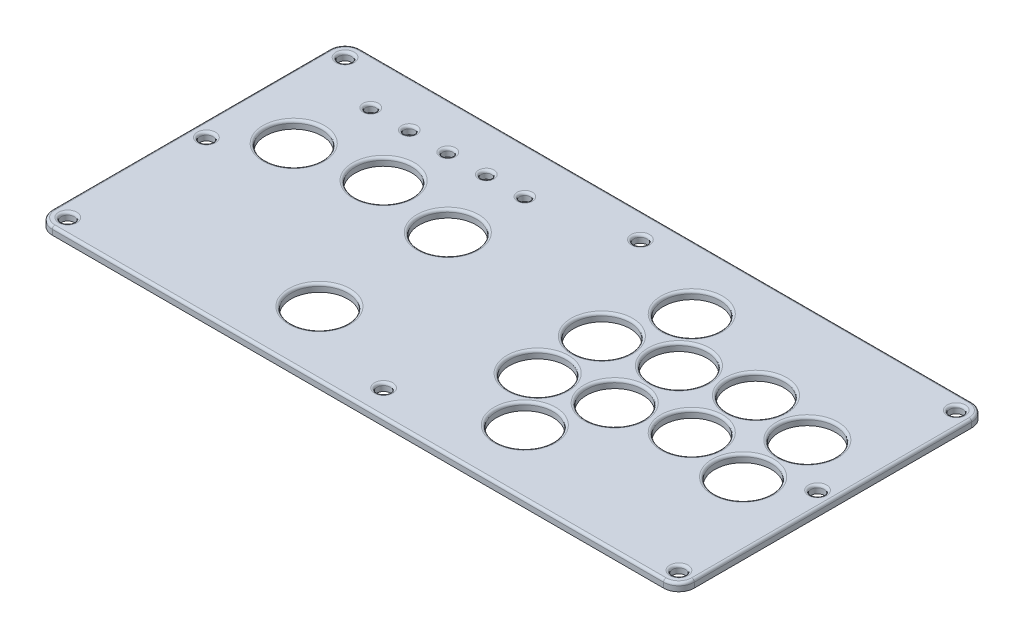
from build123d import *

# Parameters (mm, degrees)
SKETCH_1_R      = 2.55
SKETCH_1_R_2    = 11
SKETCH_1_R_3    = 2
EXTRUDE_1_DEPTH = 3
FILLET_1_R      = 1


with BuildPart() as part:
    # 草图1 → 凸台-拉伸1 (new body)
    with BuildSketch(Plane(origin=(0, 0, 0), x_dir=(1, 0, 0), z_dir=(0, 1, 0))):
        with BuildLine():
            Line((20.903140468, 127.761317024), (258.903140468, 127.761317024))
            ThreePointArc((258.903140468, 127.761317024), (263.145781155, 126.003957711), (264.903140468, 121.761317024))
            Line((264.903140468, 121.761317024), (264.903140468, 13.761317024))
            ThreePointArc((264.903140468, 13.761317024), (263.145781155, 9.518676337), (258.903140468, 7.761317024))
            Line((258.903140468, 7.761317024), (20.903140468, 7.761317024))
            ThreePointArc((20.903140468, 7.761317024), (16.660499781, 9.518676337), (14.903140468, 13.761317024))
            Line((14.903140468, 13.761317024), (14.903140468, 121.761317024))
            ThreePointArc((14.903140468, 121.761317024), (16.660499781, 126.003957711), (20.903140468, 127.761317024))
        make_face()
        with Locations((20.903140468, 121.761317024)):
            Circle(SKETCH_1_R, mode=Mode.SUBTRACT)
        with Locations((258.903140468, 121.761317024)):
            Circle(SKETCH_1_R, mode=Mode.SUBTRACT)
        with Locations((139.903140468, 117.761317024)):
            Circle(SKETCH_1_R, mode=Mode.SUBTRACT)
        with Locations((20.903140468, 13.761317024)):
            Circle(SKETCH_1_R, mode=Mode.SUBTRACT)
        with Locations((258.903140468, 13.761317024)):
            Circle(SKETCH_1_R, mode=Mode.SUBTRACT)
        with Locations((139.903140468, 17.761317024)):
            Circle(SKETCH_1_R, mode=Mode.SUBTRACT)
        with Locations((258.903140468, 67.761317024)):
            Circle(SKETCH_1_R, mode=Mode.SUBTRACT)
        with Locations((20.903140468, 67.761317024)):
            Circle(SKETCH_1_R, mode=Mode.SUBTRACT)
        with Locations((164.903140468, 77.761317024)):
            Circle(SKETCH_1_R_2, mode=Mode.SUBTRACT)
        with Locations((189.903140468, 82.761317024)):
            Circle(SKETCH_1_R_2, mode=Mode.SUBTRACT)
        with Locations((214.903140468, 87.761317024)):
            Circle(SKETCH_1_R_2, mode=Mode.SUBTRACT)
        with Locations((239.903140468, 82.761317024)):
            Circle(SKETCH_1_R_2, mode=Mode.SUBTRACT)
        with Locations((164.903140468, 52.761317024)):
            Circle(SKETCH_1_R_2, mode=Mode.SUBTRACT)
        with Locations((189.903140468, 57.761317024)):
            Circle(SKETCH_1_R_2, mode=Mode.SUBTRACT)
        with Locations((214.903140468, 62.761317024)):
            Circle(SKETCH_1_R_2, mode=Mode.SUBTRACT)
        with Locations((239.903140468, 57.761317024)):
            Circle(SKETCH_1_R_2, mode=Mode.SUBTRACT)
        with Locations((174.903140468, 102.761317024)):
            Circle(SKETCH_1_R_2, mode=Mode.SUBTRACT)
        with Locations((179.903140468, 32.761317024)):
            Circle(SKETCH_1_R_2, mode=Mode.SUBTRACT)
        with Locations((99.903140468, 82.761317024)):
            Circle(SKETCH_1_R_2, mode=Mode.SUBTRACT)
        with Locations((69.903140468, 87.761317024)):
            Circle(SKETCH_1_R_2, mode=Mode.SUBTRACT)
        with Locations((39.903140468, 82.761317024)):
            Circle(SKETCH_1_R_2, mode=Mode.SUBTRACT)
        with Locations((99.903140468, 32.761317024)):
            Circle(SKETCH_1_R_2, mode=Mode.SUBTRACT)
        with Locations((42.903140468, 109.761317024)):
            Circle(SKETCH_1_R_3, mode=Mode.SUBTRACT)
        with Locations((57.903140468, 109.761317024)):
            Circle(SKETCH_1_R_3, mode=Mode.SUBTRACT)
        with Locations((72.903140468, 109.761317024)):
            Circle(SKETCH_1_R_3, mode=Mode.SUBTRACT)
        with Locations((87.903140468, 109.761317024)):
            Circle(SKETCH_1_R_3, mode=Mode.SUBTRACT)
        with Locations((102.903140468, 109.761317024)):
            Circle(SKETCH_1_R_3, mode=Mode.SUBTRACT)
    extrude(amount=EXTRUDE_1_DEPTH)

    # 圆角1
    fillet_1_edges = [part.edges().sort_by_distance(p)[0] for p in [
        (100.903140468, 3, -109.761317024),
        (70.903140468, 3, -109.761317024),
        (40.903140468, 3, -109.761317024),
        (28.903140468, 3, -82.761317024),
        (88.903140468, 3, -82.761317024),
        (163.903140468, 3, -102.761317024),
        (203.903140468, 3, -62.761317024),
        (153.903140468, 3, -52.761317024),
        (203.903140468, 3, -87.761317024),
        (153.903140468, 3, -77.761317024),
        (256.353140468, 3, -67.761317024),
        (256.353140468, 3, -13.761317024),
        (137.353140468, 3, -117.761317024),
        (18.353140468, 3, -121.761317024),
        (139.903140468, 3, -127.761317024),
        (263.145781155, 3, -126.003957711),
        (264.903140468, 3, -67.761317024),
        (263.145781155, 3, -9.518676337),
        (139.903140468, 3, -7.761317024),
        (16.660499781, 3, -9.518676337),
        (14.903140468, 3, -67.761317024),
        (16.660499781, 3, -126.003957711),
        (256.353140468, 3, -121.761317024),
        (18.353140468, 3, -13.761317024),
        (137.353140468, 3, -17.761317024),
        (18.353140468, 3, -67.761317024),
        (178.903140468, 3, -82.761317024),
        (228.903140468, 3, -82.761317024),
        (178.903140468, 3, -57.761317024),
        (228.903140468, 3, -57.761317024),
        (168.903140468, 3, -32.761317024),
        (58.903140468, 3, -87.761317024),
        (88.903140468, 3, -32.761317024),
        (55.903140468, 3, -109.761317024),
        (85.903140468, 3, -109.761317024),
    ]]
    fillet(fillet_1_edges, radius=FILLET_1_R)


solid = part.part
